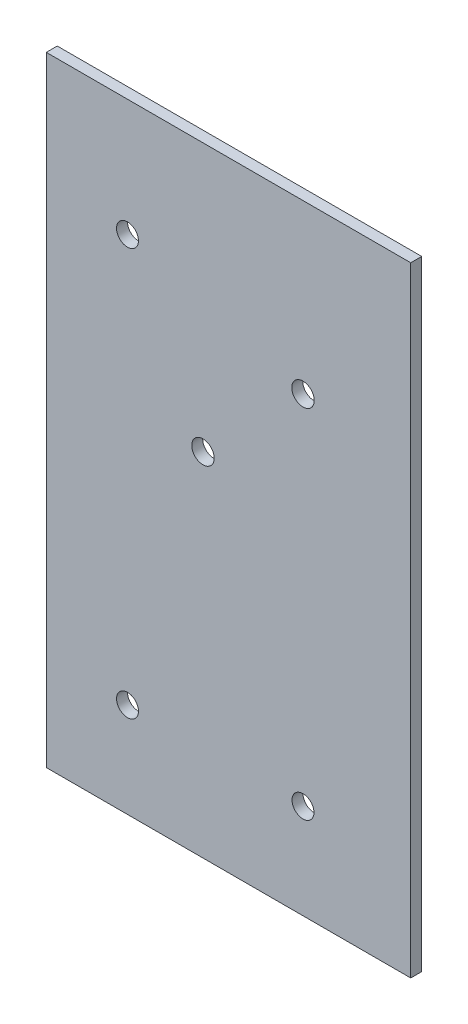
from build123d import *

# Parameters (mm, degrees)
SKETCH1_W           = 105.497827183
SKETCH1_H           = 179.29887024
SKETCH1_R           = 3.175
SKETCH1_R_2         = 3.2512
BOSS_EXTRUDE1_DEPTH = 3.175


with BuildPart() as part:
    # Sketch1 → Boss-Extrude1 (new body)
    with BuildSketch(Plane.XY):
        with Locations((54.6380005, 121.166691813)):
            Rectangle(SKETCH1_W, SKETCH1_H)
        with Locations((25.4, 58.964285714)):
            Circle(SKETCH1_R, mode=Mode.SUBTRACT)
        with Locations((76.2, 58.964285714)):
            Circle(SKETCH1_R, mode=Mode.SUBTRACT)
        with Locations((25.4, 176.892857143)):
            Circle(SKETCH1_R, mode=Mode.SUBTRACT)
        with Locations((47.244, 133.35)):
            Circle(SKETCH1_R_2, mode=Mode.SUBTRACT)
        with Locations((76.2, 162.306)):
            Circle(SKETCH1_R_2, mode=Mode.SUBTRACT)
    extrude(amount=BOSS_EXTRUDE1_DEPTH)


solid = part.part
